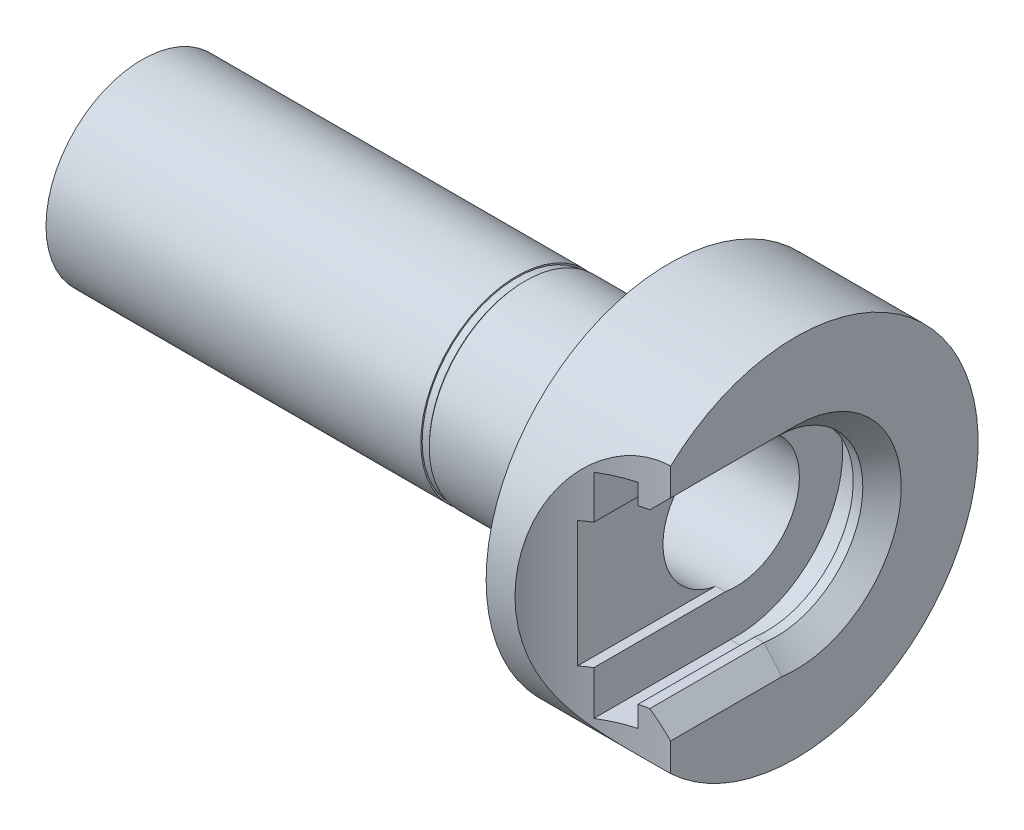
from build123d import *

# Parameters (mm, degrees)
CHANFRO3_SIZE              = 0.2
ESBO_O3_W                  = 12.082799142
ESBO_O3_H                  = 11.091873023
CORTE_EXTRUS_O1_DEPTH      = 1.6
ESBO_O4_W                  = 12.202436568
ESBO_O4_H                  = 8.953230152
CORTE_EXTRUS_O2_DEPTH      = 4
ESBO_O11_R                 = 6.241505963
CORTE_EXTRUS_O5_DEPTH      = 1
ESBO_O5_W                  = 9.712143391
ESBO_O5_H                  = 6.552029914
CORTE_EXTRUS_O3_DEPTH      = 0.5
CORTE_EXTRUS_O4_DEPTH      = 38.504431422
CORTE_EXTRUS_O4_DEPTH_BACK = 38.504431422
CHANFRO6_SIZE              = 1


with BuildPart() as part:
    # Esboço1 → Revolução1 (revolve)
    with BuildSketch(Plane(origin=(0, 0, 0), x_dir=(1, 0, 0), z_dir=(0, 1, 0)), mode=Mode.PRIVATE) as revolu_o1_sk:
        Polygon((35.015459104, 4.5), (35.015459104, 9.5), (28.415459104, 9.5), (28.415459104, 5), (20.75612147, 5), (20.75612147, 4.928604204), (20.515459104, 4.928604204), (20.515459104, 5), (0.015459104, 5), (0.015459104, 3.3), (31.915459104, 3.3), (31.915459104, 5.55), (33.515459104, 5.55), (33.515459104, 4.5), align=None)
    revolve(revolu_o1_sk.sketch.rotate(Axis((0, 0, 0), (1, 0, 0)), 180), axis=Axis((0, 0, 0), (1, 0, 0)))

    # Chanfro3
    # the kernel refuses this chamfer: 0.2 mm, written as the material it takes off along each edge
    with BuildSketch(Plane(origin=(20.75612147, 0, 0), x_dir=(0, 0, 1), z_dir=(0, 1, 0))) as chanfro3_piece_1_section:
        Polygon((5, CHANFRO3_SIZE), (5 - CHANFRO3_SIZE, 0), (5, 0), align=None)
    chanfro3_piece_1 = revolve(axis=Axis((20.75612147, 0, 0), (1, 0, 0)), mode=Mode.PRIVATE)
    chanfro3_piece_1 = chanfro3_piece_1 - Plane(origin=(20.918018136, 0, 0), x_dir=(0, 0, 1), z_dir=(-1, 0, 0)) * Cylinder(4.928604204, 21, mode=Mode.PRIVATE)
    add(chanfro3_piece_1, mode=Mode.SUBTRACT)

    # Esboço3 → Corte-extrusão1 (cut)
    with BuildSketch(Plane(origin=(31.915459104, 0, 0), x_dir=(0, 0, -1), z_dir=(1, 0, 0))):
        with Locations((-6.041399571, 0.003483257)):
            Rectangle(ESBO_O3_W, ESBO_O3_H)
    extrude(amount=CORTE_EXTRUS_O1_DEPTH, mode=Mode.SUBTRACT)

    # Esboço4 → Corte-extrusão2 (cut)
    with BuildSketch(Plane(origin=(31.915459104, 0, 0), x_dir=(0, 0, -1), z_dir=(1, 0, 0))):
        with Locations((-6.101218284, 0.023384924)):
            Rectangle(ESBO_O4_W, ESBO_O4_H)
    extrude(amount=CORTE_EXTRUS_O2_DEPTH, mode=Mode.SUBTRACT)

    # Esboço11 → Corte-extrusão5 (cut)
    with BuildSketch(Plane.ZY.offset(-0.015459104)):
        Circle(ESBO_O11_R)
    extrude(amount=-CORTE_EXTRUS_O5_DEPTH, mode=Mode.SUBTRACT)

    # Esboço5 → Corte-extrusão3 (cut)
    with BuildSketch(Plane(origin=(31.915459104, 0, 0), x_dir=(0, 0, -1), z_dir=(1, 0, 0))):
        with Locations((-4.856071696, 0.023985043)):
            Rectangle(ESBO_O5_W, ESBO_O5_H)
    extrude(amount=-CORTE_EXTRUS_O3_DEPTH, mode=Mode.SUBTRACT)

    # Esboço6 → Corte-extrusão4 (cut, two sides: drawn at the far end of the back side and taken through both)
    with BuildSketch(Plane(origin=(0, 0, 0), x_dir=(1, 0, 0), z_dir=(0, 1, 0)).offset(-CORTE_EXTRUS_O4_DEPTH_BACK)):
        with BuildLine():
            ThreePointArc((29.915459104, -9.5), (32.056996665, -7.305613855), (35.015459104, -6.5))
            add(Edge.make_bspline(
                [(29.915459104, -9.5), (30.631864389, -12.277391552), (37.640288769, -12.30241828), (36.765568572, -6.851347348), (35.015459104, -6.5)],
                knots=[0, 0, 0, 0, 0.632855425, 1, 1, 1, 1], degree=3))
        make_face()
    extrude(amount=CORTE_EXTRUS_O4_DEPTH + CORTE_EXTRUS_O4_DEPTH_BACK, mode=Mode.SUBTRACT)

    # Chanfro6
    chanfro6_edges = [part.edges().sort_by_distance(p)[0] for p in [
        (35.015459104, -4.453230152, 3.573551082),
        (35.015459104, 4.5, 3.25),
        (35.015459104, -0.324395064, -4.488292308),
    ]]
    chamfer(chanfro6_edges, length=CHANFRO6_SIZE)


solid = part.part
